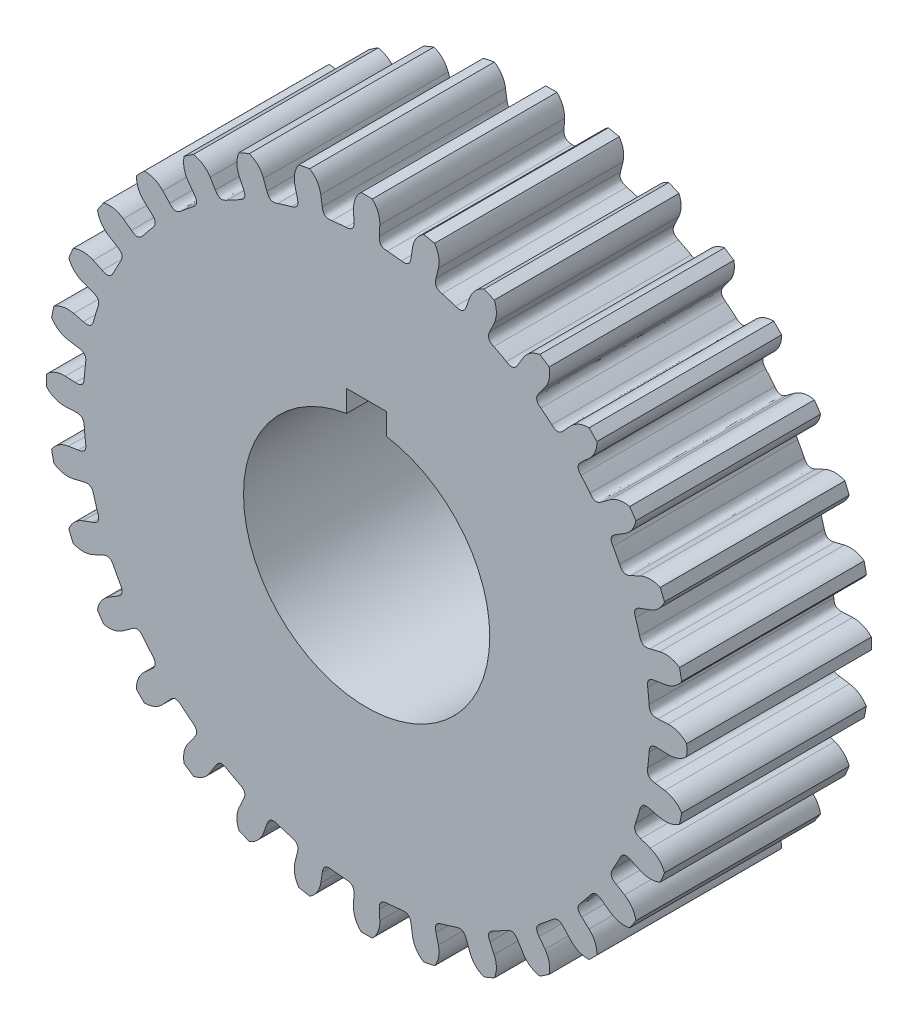
from build123d import *

# Parameters (mm, degrees)
BOSS_EXTRUDE1_DEPTH = 7.5
CIRPATTERN1_COUNT   = 32
SKETCH2_W           = 3.25
SKETCH2_H           = 3.25
CUT_EXTRUDE1_DEPTH  = 40.711459472


with BuildPart() as part:
    # Sketch1 → Boss-Extrude1 (new, symmetric)
    with BuildSketch(Plane.XY):
        with BuildLine():
            Line((1.003245909, 22.978109096), (1.06867499, 24.476681429))
            ThreePointArc((1.06867499, 24.476681429), (0.926397967, 25.303211811), (0.453762567, 25.996040074))
            ThreePointArc((0.453762567, 25.996040074), (0, 26), (-0.453762567, 25.996040074))
            ThreePointArc((-0.453762567, 25.996040074), (-0.926397967, 25.303211811), (-1.06867499, 24.476681429))
            Line((-1.06867499, 24.476681429), (-1.003245909, 22.978109096))
            ThreePointArc((-1.003245909, 22.978109096), (-1.704495274, 22.936754257), (-2.404154655, 22.874003593))
            Line((-2.404154655, 22.874003593), (-1.045284633, 9.945218954))
            ThreePointArc((-1.045284633, 9.945218954), (0, 10), (1.045284633, 9.945218954))
            Line((1.045284633, 9.945218954), (2.404154655, 22.874003593))
            ThreePointArc((2.404154655, 22.874003593), (1.704495274, 22.936754257), (1.003245909, 22.978109096))
        make_face()
    boss_extrude1 = extrude(amount=BOSS_EXTRUDE1_DEPTH, both=True)

    # Fillet1
    # a fillet whose section is not a circle: 0.7 mm, written as the material it adds along each edge
    with BuildSketch(Plane(origin=(-1.003245909, 22.978109096, -7.5), x_dir=(-0.9982950113029821, -0.05837011570640181, 0), z_dir=(0, 0, 1))) as fillet1_piece_1:
        with BuildLine():
            add(Edge.make_bspline([(0.679399, 0), (0.564559864, -0.001696307), (0.449720727, -0.003392613), (0.196977962, -0.054992569), (0.044806602, -0.207163928), (-0.006793353, -0.459906693), (-0.00848966, -0.57474583), (-0.010185966, -0.689584967)], knots=[0, 0, 0, 0, 0, 0, 0.5, 0.5, 1, 1, 1, 1, 1, 1], degree=5))
            Line((-0.010185966, -0.689584967), (0, 0))
            ThreePointArc((0, 0), (0.3396995, -0.00250874), (0.679399, 0))
        make_face()
    extrude(amount=15)
    with BuildSketch(Plane(origin=(1.003245909, 22.978109096, -7.5), x_dir=(0.04361938736533763, 0.9990482215818576, 0), z_dir=(0, 0, 1))) as fillet1_piece_2:
        with BuildLine():
            add(Edge.make_bspline([(0.689660192, 0), (0.574808527, 0), (0.459956863, 0), (0.206479559, -0.047861432), (0.052077296, -0.197768692), (-0.003249927, -0.44972178), (-0.00664217, -0.564523337), (-0.010034413, -0.679324895)], knots=[0, 0, 0, 0, 0, 0, 0.5, 0.5, 1, 1, 1, 1, 1, 1], degree=5))
            ThreePointArc((-0.010034413, -0.679324895), (-0.00250874, -0.3396995), (0, 0))
            Line((0, 0), (0.689660192, 0))
        make_face()
    extrude(amount=15)

    # CirPattern1: Boss-Extrude1 ×32 about axis
    cirpattern1_axis = Axis((0, 0, -8.25), (0, 0, 1))
    for i in range(1, CIRPATTERN1_COUNT):
        add(boss_extrude1.rotate(cirpattern1_axis, i * 360 / CIRPATTERN1_COUNT))

    # Fillet1 of CirPattern1
    # a fillet whose section is not a circle: 0.7 mm, written as the material it adds along each edge
    with BuildSketch(Plane(origin=(-5.466775524, 22.340867606, -7.5), x_dir=(-0.2376858923261727, 0.9713420698132615, 0), z_dir=(0, 0, 1)), Plane(origin=(-9.72022002, 20.845079102, -7.5), x_dir=(-0.4226182617406999, 0.9063077870366497, 0), z_dir=(0, 0, 1)), Plane(origin=(-13.600121912, 18.548225898, -7.5), x_dir=(-0.5913096483635826, 0.8064446042674824, 0), z_dir=(0, 0, 1)), Plane(origin=(-16.957378747, 15.538574775, -7.5), x_dir=(-0.7372773368101204, 0.6755902076156641, 0), z_dir=(0, 0, 1)), Plane(origin=(-19.662973025, 11.931784938, -7.5), x_dir=(-0.8549118706729473, 0.5187732581605202, 0), z_dir=(0, 0, 1)), Plane(origin=(-21.612930278, 7.866463296, -7.5), x_dir=(-0.9396926207859071, 0.34202014332567227, 0), z_dir=(0, 0, 1)), Plane(origin=(-22.732314741, 3.498837882, -7.5), x_dir=(-0.9883615104677606, 0.15212338618991741, 0), z_dir=(0, 0, 1)), Plane(origin=(-22.978109096, -1.003245909, -7.5), x_dir=(-0.9990482215818577, -0.043619387365335965, 0), z_dir=(0, 0, 1)), Plane(origin=(-22.340867606, -5.466775524, -7.5), x_dir=(-0.9713420698132612, -0.23768589232617393, 0), z_dir=(0, 0, 1)), Plane(origin=(-20.845079102, -9.72022002, -7.5), x_dir=(-0.9063077870366487, -0.42261826174070216, 0), z_dir=(0, 0, 1)), Plane(origin=(-18.548225898, -13.600121912, -7.5), x_dir=(-0.8064446042674812, -0.5913096483635842, 0), z_dir=(0, 0, 1)), Plane(origin=(-15.538574775, -16.957378747, -7.5), x_dir=(-0.6755902076156641, -0.7372773368101204, 0), z_dir=(0, 0, 1)), Plane(origin=(-11.931784938, -19.662973025, -7.5), x_dir=(-0.5187732581605224, -0.854911870672946, 0), z_dir=(0, 0, 1)), Plane(origin=(-7.866463296, -21.612930278, -7.5), x_dir=(-0.3420201433256692, -0.9396926207859083, 0), z_dir=(0, 0, 1)), Plane(origin=(-3.498837882, -22.732314741, -7.5), x_dir=(-0.15212338618991614, -0.9883615104677608, 0), z_dir=(0, 0, 1)), Plane(origin=(1.003245909, -22.978109096, -7.5), x_dir=(0.043619387365336285, -0.9990482215818577, 0), z_dir=(0, 0, 1)), Plane(origin=(5.466775524, -22.340867606, -7.5), x_dir=(0.2376858923261722, -0.9713420698132615, 0), z_dir=(0, 0, 1)), Plane(origin=(9.72022002, -20.845079102, -7.5), x_dir=(0.42261826174069583, -0.9063077870366516, 0), z_dir=(0, 0, 1)), Plane(origin=(13.600121912, -18.548225898, -7.5), x_dir=(0.5913096483635776, -0.8064446042674862, 0), z_dir=(0, 0, 1)), Plane(origin=(16.957378747, -15.538574775, -7.5), x_dir=(0.7372773368101204, -0.6755902076156641, 0), z_dir=(0, 0, 1)), Plane(origin=(19.662973025, -11.931784938, -7.5), x_dir=(0.8549118706729449, -0.518773258160524, 0), z_dir=(0, 0, 1)), Plane(origin=(21.612930278, -7.866463296, -7.5), x_dir=(0.9396926207859071, -0.34202014332567227, 0), z_dir=(0, 0, 1)), Plane(origin=(22.732314741, -3.498837882, -7.5), x_dir=(0.9883615104677609, -0.15212338618991603, 0), z_dir=(0, 0, 1)), Plane(origin=(22.978109096, 1.003245909, -7.5), x_dir=(0.9990482215818577, 0.04361938736533619, 0), z_dir=(0, 0, 1)), Plane(origin=(22.340867606, 5.466775524, -7.5), x_dir=(0.9713420698132612, 0.23768589232617393, 0), z_dir=(0, 0, 1)), Plane(origin=(20.845079102, 9.72022002, -7.5), x_dir=(0.906307787036649, 0.4226182617407015, 0), z_dir=(0, 0, 1)), Plane(origin=(18.548225898, 13.600121912, -7.5), x_dir=(0.8064446042674831, 0.5913096483635818, 0), z_dir=(0, 0, 1)), Plane(origin=(15.538574775, 16.957378747, -7.5), x_dir=(0.6755902076156618, 0.7372773368101225, 0), z_dir=(0, 0, 1)), Plane(origin=(11.931784938, 19.662973025, -7.5), x_dir=(0.518773258160524, 0.8549118706729449, 0), z_dir=(0, 0, 1)), Plane(origin=(7.866463296, 21.612930278, -7.5), x_dir=(0.3420201433256683, 0.9396926207859085, 0), z_dir=(0, 0, 1)), Plane(origin=(3.498837882, 22.732314741, -7.5), x_dir=(0.152123386189916, 0.9883615104677608, 0), z_dir=(0, 0, 1))) as fillet1_of_cirpattern1_piece_1:
        with BuildLine():
            add(Edge.make_bspline([(0.689660192, 0), (0.574808527, 0), (0.459956863, 0), (0.206479559, 0.047861432), (0.052077296, 0.197768692), (-0.003249927, 0.44972178), (-0.00664217, 0.564523337), (-0.010034413, 0.679324895)], knots=[0, 0, 0, 0, 0, 0, 0.5, 0.5, 1, 1, 1, 1, 1, 1], degree=5))
            ThreePointArc((-0.010034413, 0.679324895), (-0.00250874, 0.3396995), (0, 0))
            Line((0, 0), (0.689660192, 0))
        make_face()
    extrude(amount=15)
    with BuildSketch(Plane(origin=(-3.498837882, 22.732314741, -7.5), x_dir=(0.9905004972552193, 0.1375091449219421, 0), z_dir=(0, 0, 1)), Plane(origin=(-7.866463296, 21.612930278, -7.5), x_dir=(0.9446416045770168, 0.32810400622692654, 0), z_dir=(0, 0, 1)), Plane(origin=(-11.931784938, 19.662973025, -7.5), x_dir=(0.8624806647960318, 0.5060900145754657, 0), z_dir=(0, 0, 1)), Plane(origin=(-15.538574775, 16.957378747, -7.5), x_dir=(0.7471750767516696, 0.6646272674824112, 0), z_dir=(0, 0, 1)), Plane(origin=(-18.548225898, 13.600121912, -7.5), x_dir=(0.6031559695283514, 0.7976232672272758, 0), z_dir=(0, 0, 1)), Plane(origin=(-20.845079102, 9.72022002, -7.5), x_dir=(0.4359579166498198, 0.8999670521248813, 0), z_dir=(0, 0, 1)), Plane(origin=(-22.340867606, 5.466775524, -7.5), x_dir=(0.25200624552244943, 0.967725607916665, 0), z_dir=(0, 0, 1)), Plane(origin=(-22.978109096, 1.003245909, -7.5), x_dir=(0.05837011570638718, 0.998295011302983, 0), z_dir=(0, 0, 1)), Plane(origin=(-22.732314741, -3.498837882, -7.5), x_dir=(-0.13750914492194224, 0.990500497255219, 0), z_dir=(0, 0, 1)), Plane(origin=(-21.612930278, -7.866463296, -7.5), x_dir=(-0.3281040062269225, 0.9446416045770183, 0), z_dir=(0, 0, 1)), Plane(origin=(-19.662973025, -11.931784938, -7.5), x_dir=(-0.5060900145754614, 0.8624806647960344, 0), z_dir=(0, 0, 1)), Plane(origin=(-16.957378747, -15.538574775, -7.5), x_dir=(-0.6646272674824095, 0.747175076751671, 0), z_dir=(0, 0, 1)), Plane(origin=(-13.600121912, -18.548225898, -7.5), x_dir=(-0.7976232672272789, 0.6031559695283475, 0), z_dir=(0, 0, 1)), Plane(origin=(-9.72022002, -20.845079102, -7.5), x_dir=(-0.8999670521248808, 0.43595791664982086, 0), z_dir=(0, 0, 1)), Plane(origin=(-5.466775524, -22.340867606, -7.5), x_dir=(-0.9677256079166652, 0.25200624552244916, 0), z_dir=(0, 0, 1)), Plane(origin=(-1.003245909, -22.978109096, -7.5), x_dir=(-0.998295011302983, 0.058370115706387116, 0), z_dir=(0, 0, 1)), Plane(origin=(3.498837882, -22.732314741, -7.5), x_dir=(-0.9905004972552193, -0.1375091449219421, 0), z_dir=(0, 0, 1)), Plane(origin=(7.866463296, -21.612930278, -7.5), x_dir=(-0.9446416045770168, -0.3281040062269261, 0), z_dir=(0, 0, 1)), Plane(origin=(11.931784938, -19.662973025, -7.5), x_dir=(-0.8624806647960354, -0.5060900145754594, 0), z_dir=(0, 0, 1)), Plane(origin=(15.538574775, -16.957378747, -7.5), x_dir=(-0.7471750767516698, -0.6646272674824109, 0), z_dir=(0, 0, 1)), Plane(origin=(18.548225898, -13.600121912, -7.5), x_dir=(-0.6031559695283447, -0.7976232672272809, 0), z_dir=(0, 0, 1)), Plane(origin=(20.845079102, -9.72022002, -7.5), x_dir=(-0.4359579166498146, -0.8999670521248838, 0), z_dir=(0, 0, 1)), Plane(origin=(22.340867606, -5.466775524, -7.5), x_dir=(-0.2520062455224592, -0.9677256079166624, 0), z_dir=(0, 0, 1)), Plane(origin=(22.978109096, -1.003245909, -7.5), x_dir=(-0.0583701157063819, -0.9982950113029833, 0), z_dir=(0, 0, 1)), Plane(origin=(22.732314741, 3.498837882, -7.5), x_dir=(0.13750914492194208, -0.990500497255219, 0), z_dir=(0, 0, 1)), Plane(origin=(21.612930278, 7.866463296, -7.5), x_dir=(0.32810400622692687, -0.9446416045770166, 0), z_dir=(0, 0, 1)), Plane(origin=(19.662973025, 11.931784938, -7.5), x_dir=(0.5060900145754647, -0.8624806647960325, 0), z_dir=(0, 0, 1)), Plane(origin=(16.957378747, 15.538574775, -7.5), x_dir=(0.6646272674824139, -0.7471750767516673, 0), z_dir=(0, 0, 1)), Plane(origin=(13.600121912, 18.548225898, -7.5), x_dir=(0.7976232672272808, -0.6031559695283449, 0), z_dir=(0, 0, 1)), Plane(origin=(9.72022002, 20.845079102, -7.5), x_dir=(0.8999670521248854, -0.4359579166498113, 0), z_dir=(0, 0, 1)), Plane(origin=(5.466775524, 22.340867606, -7.5), x_dir=(0.9677256079166624, -0.25200624552245954, 0), z_dir=(0, 0, 1))) as fillet1_of_cirpattern1_piece_2:
        with BuildLine():
            add(Edge.make_bspline([(0.679399, 0), (0.564559864, 0.001696307), (0.449720727, 0.003392613), (0.196977962, 0.054992569), (0.044806602, 0.207163928), (-0.006793353, 0.459906693), (-0.00848966, 0.57474583), (-0.010185966, 0.689584967)], knots=[0, 0, 0, 0, 0, 0, 0.5, 0.5, 1, 1, 1, 1, 1, 1], degree=5))
            Line((-0.010185966, 0.689584967), (0, 0))
            ThreePointArc((0, 0), (0.3396995, 0.00250874), (0.679399, 0))
        make_face()
    extrude(amount=15)

    # Sketch2 → Cut-Extrude1 (cut, through all)
    with BuildSketch(Plane(origin=(0, 0, -7.5), x_dir=(-1, 0, 0), z_dir=(0, 0, -1))):
        with Locations((0, 10)):
            Rectangle(SKETCH2_W, SKETCH2_H)
    extrude(amount=-CUT_EXTRUDE1_DEPTH, mode=Mode.SUBTRACT)


solid = part.part
